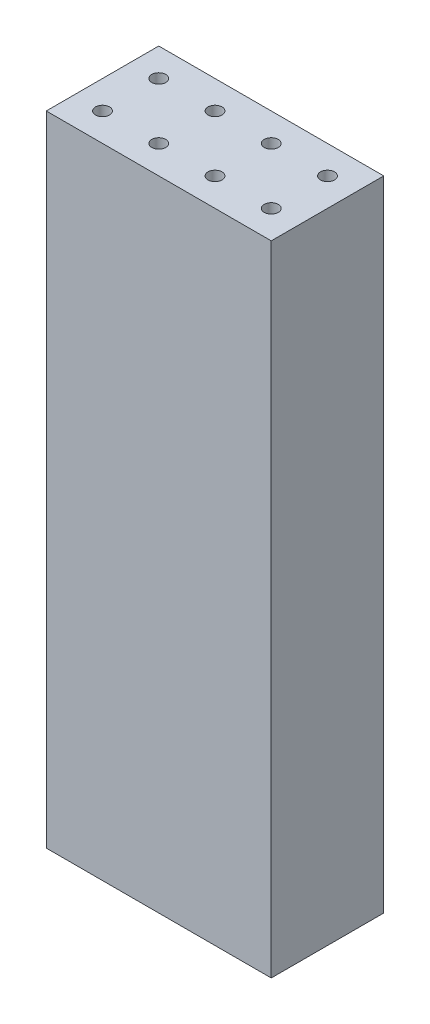
from build123d import *

# Parameters (mm, degrees)
SKETCH1_W            = 101.6
SKETCH1_H            = 50.8
BOSS_EXTRUDE1_DEPTH  = 288.29
SKETCH3_R            = 3.175
CUT_EXTRUDE1_DEPTH   = 10
LPATTERN1_COUNT      = 4
LPATTERN1_PITCH      = 25.4
LPATTERN1_COUNT_DIR2 = 2
LPATTERN1_PITCH_DIR2 = 25.4


with BuildPart() as part:
    # Sketch1 → Boss-Extrude1 (new body)
    with BuildSketch(Plane(origin=(0, 0, 0), x_dir=(1, 0, 0), z_dir=(0, 1, 0))):
        Rectangle(SKETCH1_W, SKETCH1_H)
    extrude(amount=BOSS_EXTRUDE1_DEPTH)

    # Sketch3 → Cut-Extrude1 (cut)
    with BuildSketch(Plane(origin=(0, 288.29, 0), x_dir=(1, 0, 0), z_dir=(0, 1, 0))):
        with Locations((-38.1, 12.7)):
            Circle(SKETCH3_R)
    cut_extrude1 = extrude(amount=-CUT_EXTRUDE1_DEPTH, mode=Mode.SUBTRACT)

    # LPattern1: Cut-Extrude1 4 × 2
    with Locations(*[(i * LPATTERN1_PITCH, 0, j * LPATTERN1_PITCH_DIR2) for i in range(LPATTERN1_COUNT) for j in range(LPATTERN1_COUNT_DIR2) if (i, j) != (0, 0)]):
        add(cut_extrude1, mode=Mode.SUBTRACT)


solid = part.part
